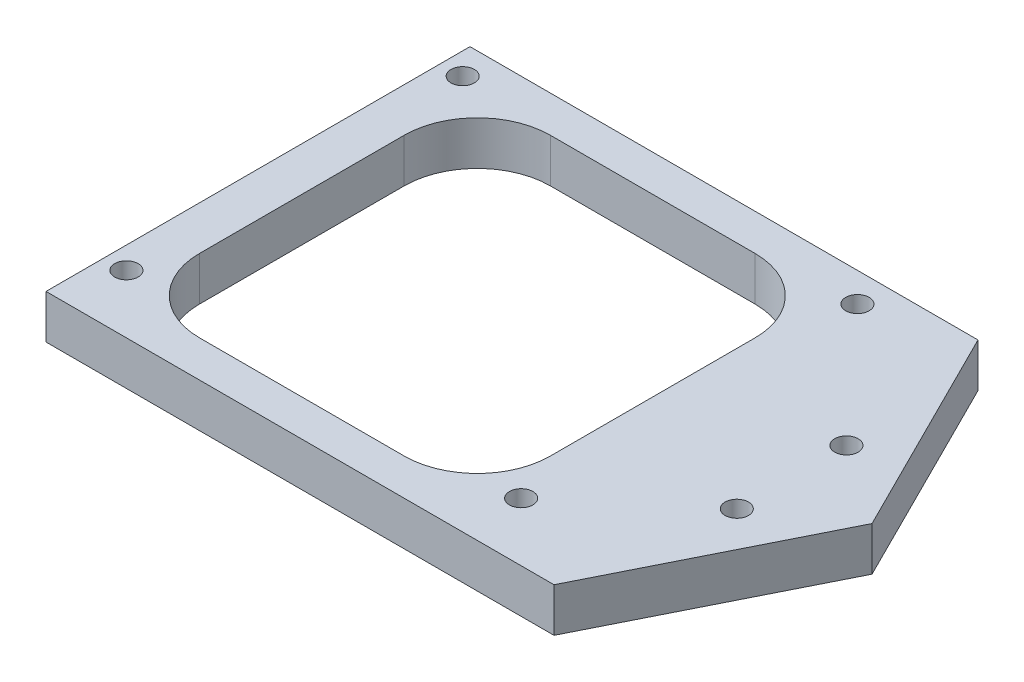
from build123d import *

# Parameters (mm, degrees)
BOSS_EXTRUDE1_DEPTH     = 1.5
CUT_EXTRUDE1_DEPTH      = 52.061237744
CUT_EXTRUDE1_DEPTH_BACK = 52.061237744
SKETCH2_W               = 24
SKETCH2_H               = 24
FILLET1_R               = 5
M2X0_4_TAPPED_HOLE1_D   = 1.6


with BuildPart() as part:
    # Sketch1 → Boss-Extrude1 (new, symmetric)
    with BuildSketch(Plane(origin=(0, 0, 0), x_dir=(1, 0, 0), z_dir=(0, 1, 0))):
        Polygon((0, 0), (34.748434417, 0), (42, 14.5), (34.748434417, 29), (0, 29), align=None)
    extrude(amount=BOSS_EXTRUDE1_DEPTH, both=True)

    # Sketch2 → Cut-Extrude1 (cut, two sides: drawn at the far end of the back side and taken through both)
    with BuildSketch(Plane(origin=(0, 0, 0), x_dir=(1, 0, 0), z_dir=(0, 1, 0)).offset(-CUT_EXTRUDE1_DEPTH_BACK)):
        with Locations((15, 14.5)):
            Rectangle(SKETCH2_W, SKETCH2_H)
    extrude(amount=CUT_EXTRUDE1_DEPTH + CUT_EXTRUDE1_DEPTH_BACK, mode=Mode.SUBTRACT)

    # Fillet1
    fillet1_edges = [part.edges().sort_by_distance(p)[0] for p in [
        (3, 0, -26.5),
        (27, 0, -26.5),
        (27, 0, -2.5),
        (3, 0, -2.5),
    ]]
    fillet(fillet1_edges, radius=FILLET1_R)

    # M2x0.4 Tapped Hole1 (through all)
    with Locations(Plane(origin=(1.5, 1.5, -27), x_dir=(0, 0, 1), z_dir=(0, 1, 0))):
        with Locations((0, 0), (0, 27), (8.75, 34.998434417), (16.25, 34.998434417), (23, 27), (23, 0)):
            Hole(M2X0_4_TAPPED_HOLE1_D / 2)


solid = part.part
